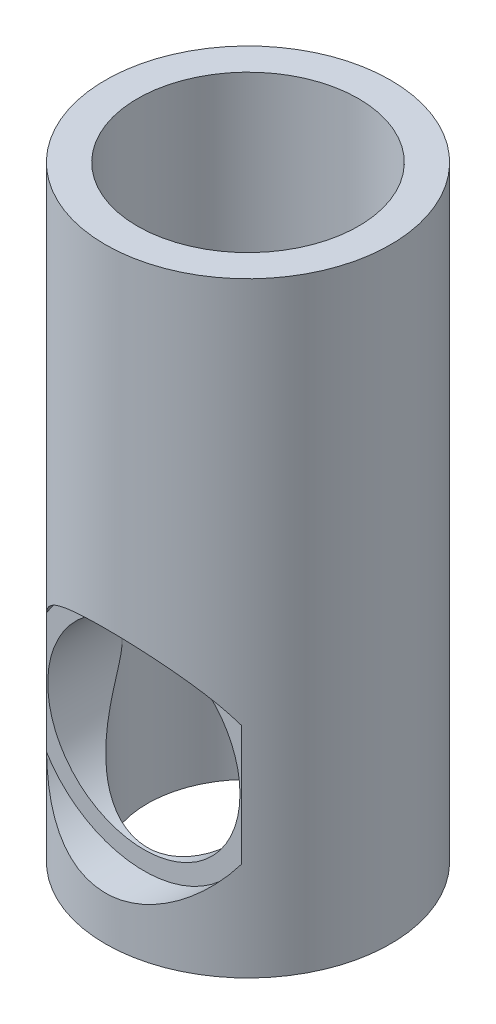
from build123d import *
from build123d.topology import SkipClean

# Parameters (mm, degrees)
SKETCH1_R               = 8.9
SKETCH1_R_2             = 6.28
BOSS_EXTRUDE1_DEPTH     = 19.3
BOSS_EXTRUDE2_START     = -18.5
SKETCH2_R               = 8.9
SKETCH2_R_2             = 6.9
BOSS_EXTRUDE2_DEPTH     = 18.5
CUT_EXTRUDE5_START      = 6.5
SKETCH3_R               = 7.15
CUT_EXTRUDE5_DEPTH      = 17.541484327
CUT_EXTRUDE6_DEPTH      = 27.24614274
CUT_EXTRUDE6_DEPTH_BACK = 7
SKETCH6_R               = 6


with BuildPart() as part:
    # Sketch1 → Boss-Extrude1 (new body)
    with BuildSketch(Plane(origin=(0, 0, 0), x_dir=(1, 0, 0), z_dir=(0, 1, 0))):
        Circle(SKETCH1_R)
        Circle(SKETCH1_R_2, mode=Mode.SUBTRACT)
    extrude(amount=-BOSS_EXTRUDE1_DEPTH)

    # Sketch2 → Boss-Extrude2 (add)
    with SkipClean():  # the faces are left unmerged after this step: merging them gives an invalid solid
        with BuildSketch(Plane(origin=(0, 0, 0), x_dir=(-1, 0, 0), z_dir=(0, -1, 0)).offset(BOSS_EXTRUDE2_START)):
            Circle(SKETCH2_R)
            Circle(SKETCH2_R_2, mode=Mode.SUBTRACT)
        extrude(amount=BOSS_EXTRUDE2_DEPTH)

    # Sketch3 → Cut-Extrude5 (cut, through all)
    with SkipClean():  # the faces are left unmerged after this step: merging them gives an invalid solid
        with BuildSketch(Plane.XY.offset(CUT_EXTRUDE5_START)):
            with Locations((0, -9.4)):
                Circle(SKETCH3_R)
        extrude(amount=CUT_EXTRUDE5_DEPTH, mode=Mode.SUBTRACT)

    # Sketch6 → Cut-Extrude6 (cut, two sides: drawn at the far end of the back side and taken through both)
    with SkipClean():  # the faces are left unmerged after this step: merging them gives an invalid solid
        with BuildSketch(Plane.XY.offset(6.5).offset(-CUT_EXTRUDE6_DEPTH_BACK)):
            with Locations((0, -9.4)):
                Circle(SKETCH6_R)
        extrude(amount=CUT_EXTRUDE6_DEPTH + CUT_EXTRUDE6_DEPTH_BACK, mode=Mode.SUBTRACT)


solid = part.part
